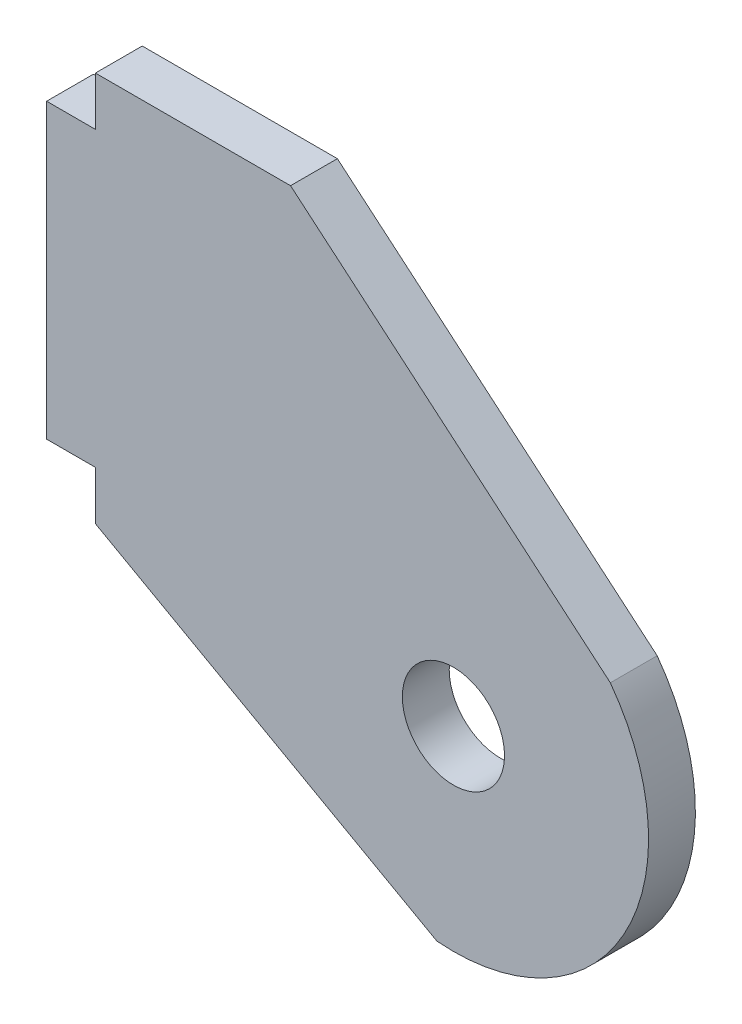
from build123d import *

# Parameters (mm, degrees)
SKETCH1_R           = 3.323611416
BOSS_EXTRUDE1_DEPTH = 3.048


with BuildPart() as part:
    # Sketch1 → Boss-Extrude1 (new body)
    with BuildSketch(Plane.XY):
        with BuildLine():
            Line((427.919423357, 0), (440.619423357, 0))
            Line((440.619423357, 0), (461.432219063, -17.609164677))
            ThreePointArc((461.432219063, -17.609164677), (462.308947418, -31.354922495), (450.144423357, -37.815484776))
            Line((450.144423357, -37.815484776), (427.919423357, -25.4))
            Line((427.919423357, -25.4), (427.919423357, -22.225))
            Line((427.919423357, -22.225), (424.744423357, -22.225))
            Line((424.744423357, -22.225), (424.744423357, -3.175))
            Line((424.744423357, -3.175), (427.919423357, -3.175))
            Line((427.919423357, -3.175), (427.919423357, 0))
        make_face()
        with Locations((451.221637357, -25.161251887)):
            Circle(SKETCH1_R, mode=Mode.SUBTRACT)
    extrude(amount=BOSS_EXTRUDE1_DEPTH)


solid = part.part
